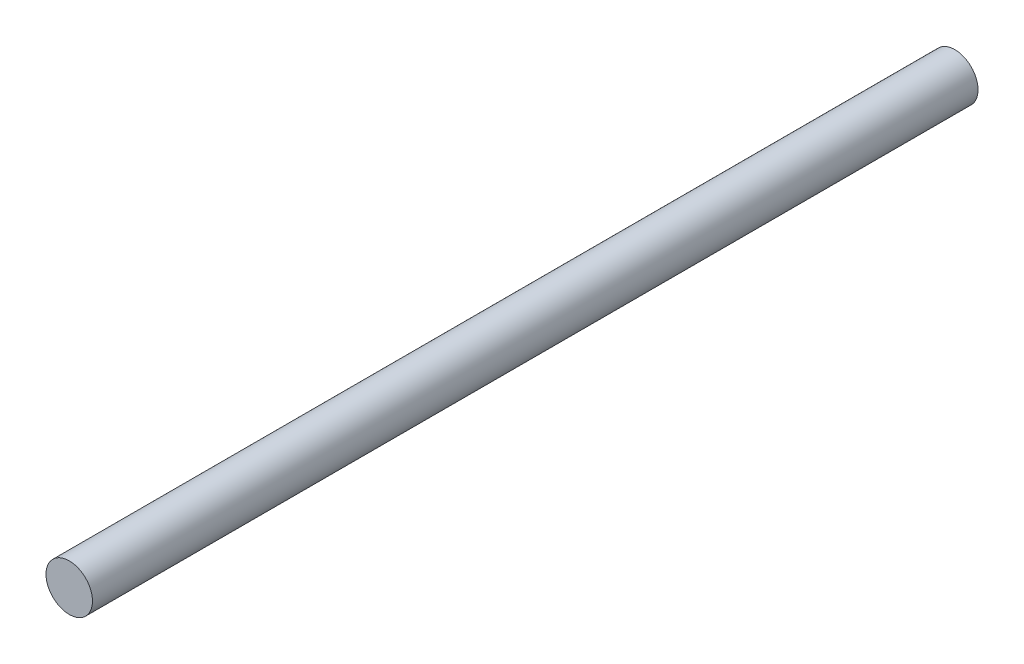
from build123d import *

# Parameters (mm, degrees)
SKETCH1_R           = 2
BOSS_EXTRUDE1_DEPTH = 76.2


with BuildPart() as part:
    # Sketch1 → Boss-Extrude1 (new body)
    with BuildSketch(Plane.XY):
        Circle(SKETCH1_R)
    extrude(amount=BOSS_EXTRUDE1_DEPTH)


solid = part.part
